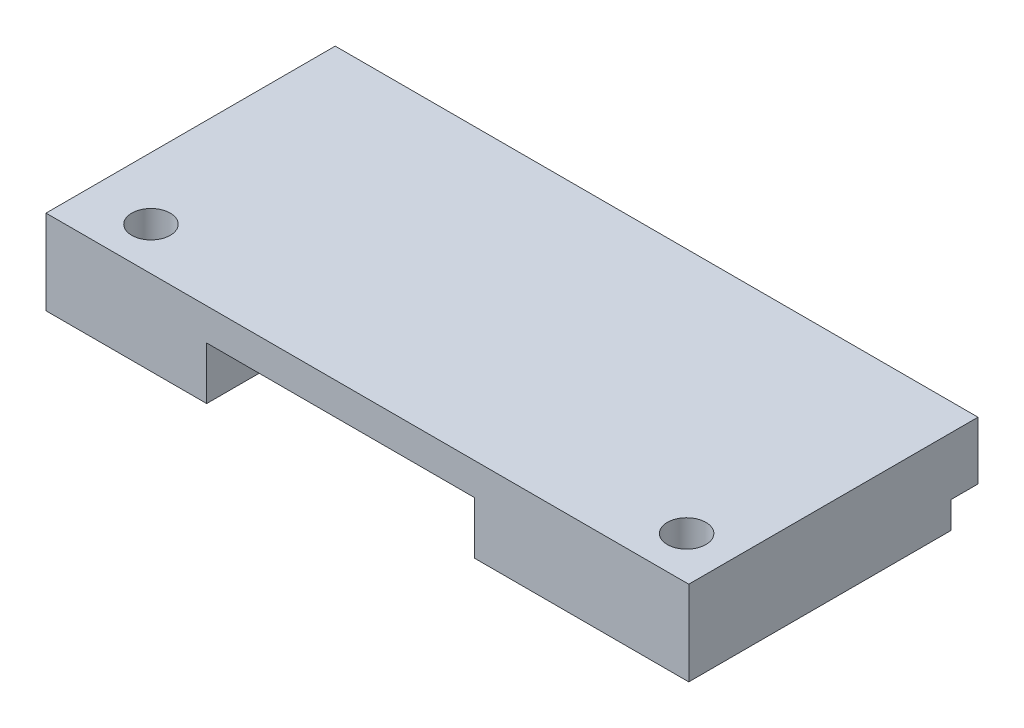
from build123d import *

# Parameters (mm, degrees)
SKETCH1_W                  = 60
SKETCH1_H                  = 2.5
BOSS_EXTRUDE1_DEPTH        = 2.5
SKETCH2_W                  = 60
SKETCH2_H                  = 5
BOSS_EXTRUDE2_DEPTH        = 3
SKETCH5_W                  = 60
SKETCH5_H                  = 5.5
BOSS_EXTRUDE4_DEPTH        = 22
SKETCH6_W                  = 60
SKETCH6_H                  = 27
BOSS_EXTRUDE5_DEPTH        = 2.4
F_3_6_3_6_DIAMETER_HOLE1_D = 3.6
SKETCH9_W                  = 25
SKETCH9_H                  = 9.609635329
CUT_EXTRUDE1_DEPTH         = 42.126755282


with BuildPart() as part:
    # Sketch1 → Boss-Extrude1 (new body)
    with BuildSketch(Plane(origin=(0, 0, 0), x_dir=(1, 0, 0), z_dir=(0, 1, 0))):
        Rectangle(SKETCH1_W, SKETCH1_H)
    extrude(amount=BOSS_EXTRUDE1_DEPTH)

    # Sketch2 → Boss-Extrude2 (add)
    with BuildSketch(Plane(origin=(0, 2.5, 0), x_dir=(1, 0, 0), z_dir=(0, 1, 0))):
        with Locations((0, 1.25)):
            Rectangle(SKETCH2_W, SKETCH2_H)
    extrude(amount=BOSS_EXTRUDE2_DEPTH)

    # Sketch5 → Boss-Extrude4 (add)
    with BuildSketch(Plane.XY.offset(1.25)):
        with Locations((0, 2.75)):
            Rectangle(SKETCH5_W, SKETCH5_H)
    extrude(amount=BOSS_EXTRUDE4_DEPTH)

    # Sketch6 → Boss-Extrude5 (add)
    with BuildSketch(Plane(origin=(0, 5.5, 0), x_dir=(1, 0, 0), z_dir=(0, 1, 0))):
        with Locations((0, -9.75)):
            Rectangle(SKETCH6_W, SKETCH6_H)
    extrude(amount=BOSS_EXTRUDE5_DEPTH)

    # Ø3.6 (3.6) Diameter Hole1 (through all)
    with Locations(Plane(origin=(0, 7.9, 0), x_dir=(1, 0, 0), z_dir=(0, 1, 0))):
        with Locations((-24.2, -19.25), (25.8, -19.25)):
            Hole(F_3_6_3_6_DIAMETER_HOLE1_D / 2)

    # Sketch9 → Cut-Extrude1 (cut, through all)
    with BuildSketch(Plane(origin=(0, 0, -3.75), x_dir=(-1, 0, 0), z_dir=(0, 0, -1))):
        with Locations((2.5, 0.095182336)):
            Rectangle(SKETCH9_W, SKETCH9_H)
    extrude(amount=-CUT_EXTRUDE1_DEPTH, mode=Mode.SUBTRACT)


solid = part.part
